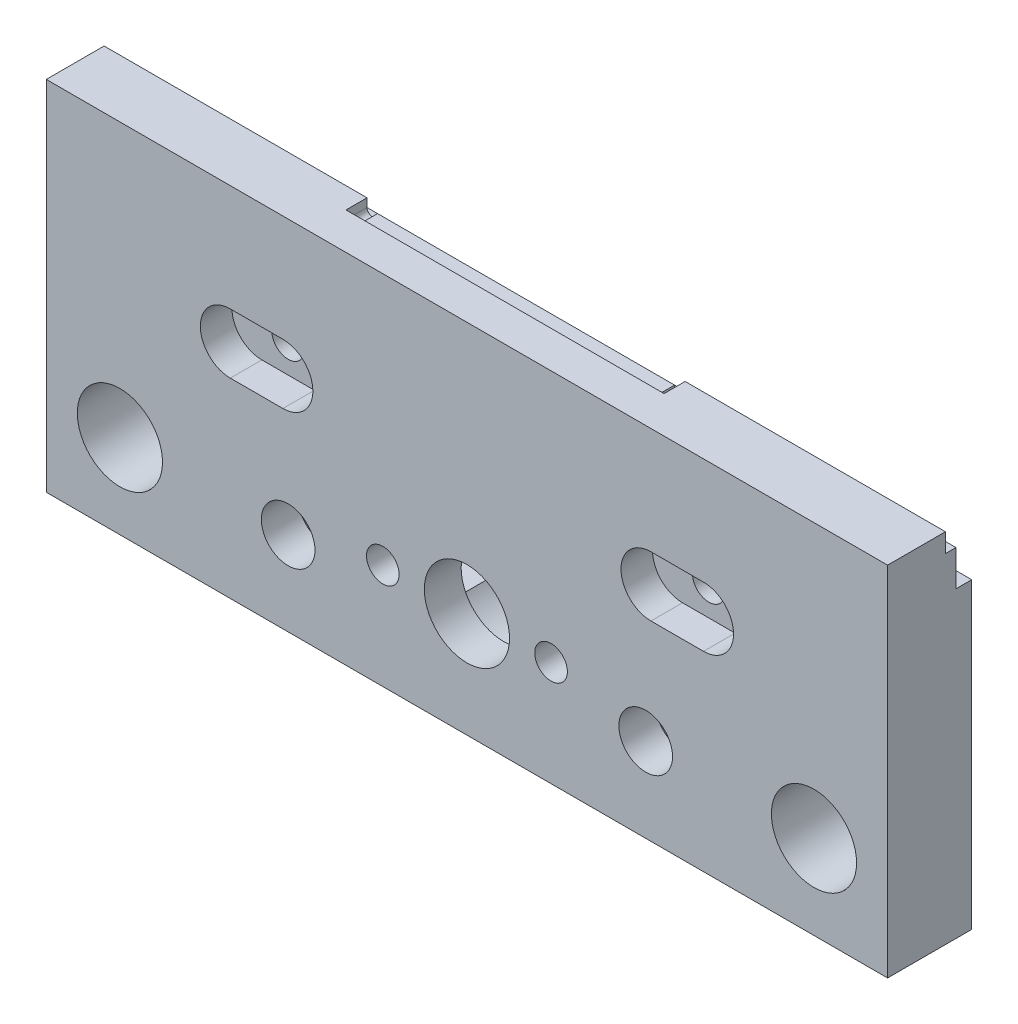
from build123d import *

# Parameters (mm, degrees)
SKETCH_2_W           = 80
SKETCH_2_H           = 34
SKETCH_2_R           = 4.05
EXTRUDE_1_DEPTH      = 8
SKETCH_3_R           = 2.55
CUT_EXTRUDE_1_DEPTH  = 88.292611371
CUT_EXTRUDE_2_DEPTH  = 88.292611371
SKETCH_5_R           = 1.55
CUT_EXTRUDE_3_DEPTH  = 88.292611371
CUT_EXTRUDE_4_DEPTH  = 4.5
CUT_EXTRUDE_5_DEPTH  = 4.5
SKETCH_20_R          = 5.5
CUT_EXTRUDE_12_DEPTH = 4.5
SKETCH_11_R          = 1.55
CUT_EXTRUDE_7_DEPTH  = 88.292611371
CUT_EXTRUDE_8_DEPTH  = 3
CUT_EXTRUDE_START    = -3
CUT_EXTRUDE_9_DEPTH  = 3
CUT_EXTRUDE_11_DEPTH = 2


with BuildPart() as part:
    # 草图2 → 凸台-拉伸1 (new body)
    with BuildSketch(Plane.XY):
        with Locations((40, 17)):
            Rectangle(SKETCH_2_W, SKETCH_2_H)
        with Locations((7, 8)):
            Circle(SKETCH_2_R, mode=Mode.SUBTRACT)
        with Locations((40, 10)):
            Circle(SKETCH_2_R, mode=Mode.SUBTRACT)
        with Locations((73, 8)):
            Circle(SKETCH_2_R, mode=Mode.SUBTRACT)
    extrude(amount=EXTRUDE_1_DEPTH)

    # 草图3 → 切除-拉伸1 (cut, through all)
    with BuildSketch(Plane.XY.offset(8)):
        with Locations((23, 8)):
            Circle(SKETCH_3_R)
        with Locations((57, 8)):
            Circle(SKETCH_3_R)
    extrude(amount=-CUT_EXTRUDE_1_DEPTH, mode=Mode.SUBTRACT)

    # 草图4 → 切除-拉伸2 (cut, through all)
    with BuildSketch(Plane(origin=(80, 0, 0), x_dir=(0, 0, -1), z_dir=(1, 0, 0))):
        Polygon((-1.5, 32.2), (-2.5, 32.2), (-2.5, 34), (0, 34), (0, 28.8), (-1.5, 28.8), align=None)
    extrude(amount=-CUT_EXTRUDE_2_DEPTH, mode=Mode.SUBTRACT)

    # 草图5 → 切除-拉伸3 (cut, through all)
    with BuildSketch(Plane.XY.offset(8)):
        with Locations((48, 10)):
            Circle(SKETCH_5_R)
        with Locations((32, 10)):
            Circle(SKETCH_5_R)
    extrude(amount=-CUT_EXTRUDE_3_DEPTH, mode=Mode.SUBTRACT)

    # 草图7 → 切除-拉伸4 (cut)
    with BuildSketch(Plane(origin=(0, 0, 0), x_dir=(-1, 0, 0), z_dir=(0, 0, -1))):
        with BuildLine():
            Line((-27.05, 10), (-27.05, 2.5))
            ThreePointArc((-27.05, 2.5), (-27.782233047, 0.732233047), (-29.55, 0))
            Line((-29.55, 0), (-16.45, 0))
            ThreePointArc((-16.45, 0), (-18.217766953, 0.732233047), (-18.95, 2.5))
            Line((-18.95, 2.5), (-18.95, 10))
            ThreePointArc((-18.95, 10), (-23, 14.05), (-27.05, 10))
        make_face()
        with BuildLine():
            Line((-61.05, 2.5), (-61.05, 10))
            ThreePointArc((-61.05, 10), (-57, 14.05), (-52.95, 10))
            Line((-52.95, 10), (-52.95, 2.5))
            ThreePointArc((-52.95, 2.5), (-52.217766953, 0.732233047), (-50.45, 0))
            Line((-50.45, 0), (-63.55, 0))
            ThreePointArc((-63.55, 0), (-61.782233047, 0.732233047), (-61.05, 2.5))
        make_face()
    extrude(amount=-CUT_EXTRUDE_4_DEPTH, mode=Mode.SUBTRACT)

    # 草图8 → 切除-拉伸5 (cut)
    with BuildSketch(Plane(origin=(0, 0, 0), x_dir=(-1, 0, 0), z_dir=(0, 0, -1))):
        with BuildLine():
            Line((-30.5, 12.85), (-49.5, 12.85))
            ThreePointArc((-49.5, 12.85), (-52.35, 10), (-49.5, 7.15))
            Line((-49.5, 7.15), (-30.5, 7.15))
            ThreePointArc((-30.5, 7.15), (-27.65, 10), (-30.5, 12.85))
        make_face()
    extrude(amount=-CUT_EXTRUDE_5_DEPTH, mode=Mode.SUBTRACT)

    # 草图20 → 切除-拉伸12 (cut)
    with BuildSketch(Plane(origin=(0, 0, 0), x_dir=(-1, 0, 0), z_dir=(0, 0, -1))):
        with Locations((-40, 10)):
            Circle(SKETCH_20_R)
    extrude(amount=-CUT_EXTRUDE_12_DEPTH, mode=Mode.SUBTRACT)

    # 草图11 → 切除-拉伸7 (cut, through all)
    with BuildSketch(Plane(origin=(0, 0, 0), x_dir=(-1, 0, 0), z_dir=(0, 0, -1))):
        with Locations((-60, 21)):
            Circle(SKETCH_11_R)
        with Locations((-20, 21)):
            Circle(SKETCH_11_R)
    extrude(amount=-CUT_EXTRUDE_7_DEPTH, mode=Mode.SUBTRACT)

    # 草图12 → 切除-拉伸8 (cut)
    with BuildSketch(Plane(origin=(0, 0, 0), x_dir=(-1, 0, 0), z_dir=(0, 0, -1))):
        with BuildLine():
            Line((-62.5, 18.15), (-57.5, 18.15))
            ThreePointArc((-57.5, 18.15), (-54.65, 21), (-57.5, 23.85))
            Line((-57.5, 23.85), (-62.5, 23.85))
            ThreePointArc((-62.5, 23.85), (-65.35, 21), (-62.5, 18.15))
        make_face()
        with BuildLine():
            Line((-17.5, 23.85), (-22.5, 23.85))
            ThreePointArc((-22.5, 23.85), (-25.35, 21), (-22.5, 18.15))
            Line((-22.5, 18.15), (-17.5, 18.15))
            ThreePointArc((-17.5, 18.15), (-14.65, 21), (-17.5, 23.85))
        make_face()
    extrude(amount=-CUT_EXTRUDE_8_DEPTH, mode=Mode.SUBTRACT)

    # 草图15 → 切除-拉伸9 (cut)
    with BuildSketch(Plane.XY.offset(8).offset(CUT_EXTRUDE_START)):
        with BuildLine():
            Line((57.5, 18.15), (62.5, 18.15))
            ThreePointArc((62.5, 18.15), (65.35, 21), (62.5, 23.85))
            Line((62.5, 23.85), (57.5, 23.85))
            ThreePointArc((57.5, 23.85), (54.65, 21), (57.5, 18.15))
        make_face()
        with BuildLine():
            Line((22.5, 23.85), (17.5, 23.85))
            ThreePointArc((17.5, 23.85), (14.65, 21), (17.5, 18.15))
            Line((17.5, 18.15), (22.5, 18.15))
            ThreePointArc((22.5, 18.15), (25.35, 21), (22.5, 23.85))
        make_face()
    extrude(amount=CUT_EXTRUDE_9_DEPTH, mode=Mode.SUBTRACT)

    # 草图19 → 切除-拉伸11 (cut)
    with BuildSketch(Plane(origin=(0, 0, 2.5), x_dir=(-1, 0, 0), z_dir=(0, 0, -1))):
        with BuildLine():
            Line((-25, 34), (-55.247938178, 34))
            Line((-55.247938178, 34), (-55.247938178, 33.2))
            ThreePointArc((-55.247938178, 33.2), (-54.747938178, 32.7), (-54.247938178, 33.2))
            Line((-54.247938178, 33.2), (-26, 33.2))
            ThreePointArc((-26, 33.2), (-25.5, 32.7), (-25, 33.2))
            Line((-25, 33.2), (-25, 34))
        make_face()
    extrude(amount=-CUT_EXTRUDE_11_DEPTH, mode=Mode.SUBTRACT)


solid = part.part
